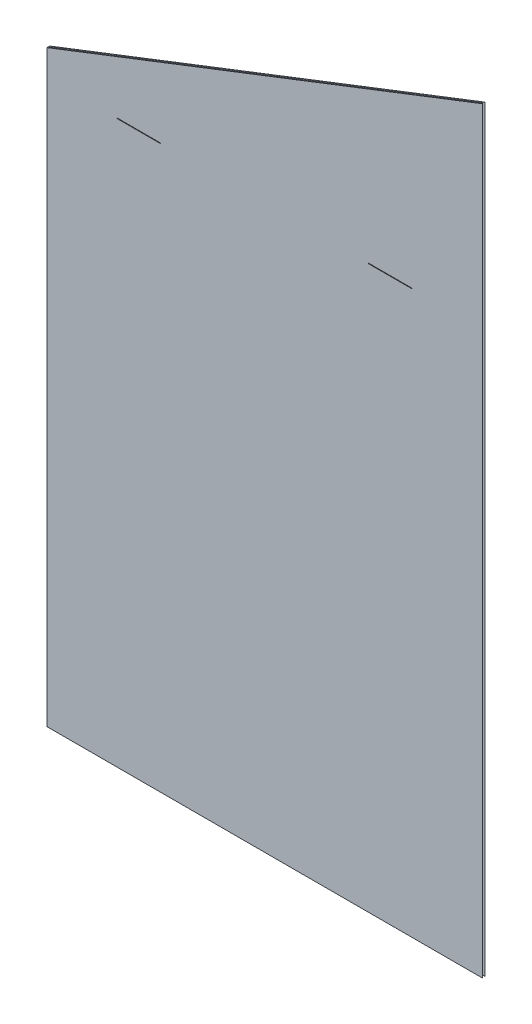
from build123d import *

# Parameters (mm, degrees)
EXTRUDE_THIN1_DEPTH = 3000
LPATTERN1_COUNT     = 210
LPATTERN1_PITCH     = 10
SKETCH4_W           = 155
SKETCH4_H           = 2
CUT_EXTRUDE2_DEPTH  = 3662.98033856


with BuildPart() as part:
    # Sketch1 → Extrude-Thin1 (new body)
    with BuildSketch(Plane(origin=(0, 0, 0), x_dir=(1, 0, 0), z_dir=(0, 1, 0))):
        Polygon((10, 10), (0, 10), (0, 0), (10, 0), (10, 0.3), (0.3, 0.3), (0.3, 9.7), (10, 9.7), align=None)
    extrude_thin1 = extrude(amount=EXTRUDE_THIN1_DEPTH)

    # LPattern1: Extrude-Thin1 ×210
    with Locations(*[(i * LPATTERN1_PITCH, 0, 0) for i in range(1, LPATTERN1_COUNT)]):
        add(extrude_thin1)

    # Sketch4 → Cut-Extrude2 (cut, through all)
    with BuildSketch(Plane(origin=(0, 0, -10), x_dir=(-1, 0, 0), z_dir=(0, 0, -1))):
        Polygon((0, 0), (0, 50), (-1548.8, 50), (-1548.8, 2743.2), (0, 2141.7), (0, 3000), (-2100, 3000), (-2100, 0), align=None)
        with Locations((-327.5, 2049)):
            Rectangle(SKETCH4_W, SKETCH4_H)
        with Locations((-1221.3, 2049)):
            Rectangle(SKETCH4_W, SKETCH4_H)
    extrude(amount=-CUT_EXTRUDE2_DEPTH, mode=Mode.SUBTRACT)


solid = part.part
